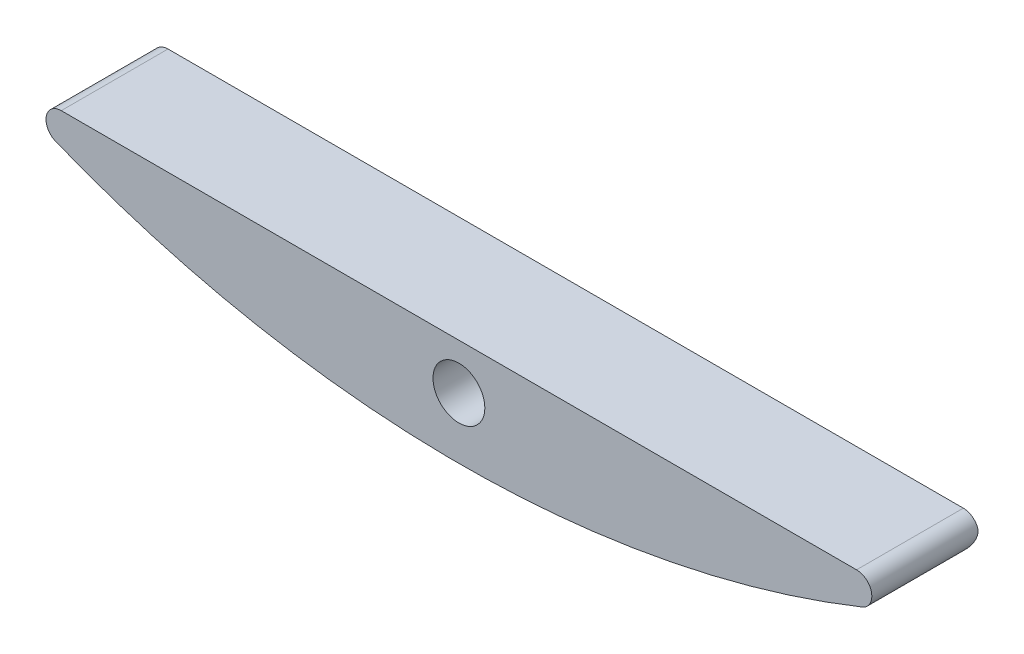
from build123d import *

# Parameters (mm, degrees)
EXTRUDE_START            = -2.25
EXTRUDE_2_OUTLINE_R      = 7.6
EXTRUDE_2_DEPTH          = 4.5
FILLET_1_R               = 20
EXTRUDE_6_DEPTH          = 7
FILLET_5_R               = 1
CUT_EXTRUDE_3_DEPTH      = 120.048972165
CUT_EXTRUDE_3_DEPTH_BACK = 120.048972165


# Read off the part's stored shape, not the designer's step: Бобышка-Вытянуть2
with BuildPart() as part:
    # Бобышка-Вытянуть2 outline → Бобышка-Вытянуть2 (new body)
    with BuildSketch(Plane.XY.offset(EXTRUDE_START)):
        with BuildLine():
            add(Edge.make_bspline(
                [(-65.4, -39.40914805), (-65.4, -47.175816893), (-62.002230156, -62.709154577), (-47.47251585, -82.482509686), (-25.700369735, -95.710351943), (0, -100.358546104), (25.700369735, -95.710351943), (47.47251585, -82.482509686), (62.002230156, -62.709154577), (67.098884922, -39.40914805), (62.002230156, -16.109141524), (47.47251585, 3.664213585), (25.700369735, 16.892055843), (0, 21.540250003), (-25.700369735, 16.892055843), (-47.47251585, 3.664213585), (-62.002230156, -16.109141524), (-65.4, -31.642479208), (-65.4, -39.40914805)],
                knots=[0, 0, 0, 0, 0.392699082, 0.785398163, 1.178097245, 1.570796327, 1.963495408, 2.35619449, 2.748893572, 3.141592654, 3.534291735, 3.926990817, 4.319689899, 4.71238898, 5.105088062, 5.497787144, 5.890486225, 6.283185307, 6.283185307, 6.283185307, 6.283185307], degree=3))
        make_face()
        with BuildLine():
            add(Edge.make_bspline(
                [(-50.377711226, -9.40914805), (-50.920216849, -10.147880044), (-53.009488643, -13.148970519), (-58.287053578, -22.675724676), (-60.4, -32.361278425), (-60.4, -39.40914805), (-60.4, -46.457017676), (-57.531501115, -59.605955028), (-48.578428032, -72.525678375), (-42.381106639, -78.200739223), (-40.925271095, -79.40914805)],
                knots=[5.694527978, 5.694527978, 5.694527978, 5.694527978, 5.74351754, 5.890486225, 6.283185307, 6.283185307, 6.283185307, 6.675884389, 7.015828772, 7.114003543, 7.114003543, 7.114003543, 7.114003543], degree=3))
            Line((-50.377711226, -9.40914805), (-12.131830741, -18.974848484))
            ThreePointArc((-12.131830741, -18.974848484), (0, -20.468986128), (12.131830741, -18.974848484))
            Line((12.131830741, -18.974848484), (50.373795788, -9.410127343))
            add(Edge.make_bspline(
                [(40.925271095, -79.40914805), (42.381106639, -78.200739223), (48.578428032, -72.525678375), (57.531501115, -59.605955028), (61.937523955, -39.40914805), (58.09524141, -21.796475187), (52.543848483, -12.36529325), (50.373795788, -9.410127343)],
                knots=[2.310774418, 2.310774418, 2.310774418, 2.310774418, 2.408949189, 2.748893572, 3.141592654, 3.534291735, 3.730251177, 3.730251177, 3.730251177, 3.730251177], degree=3))
            Line((40.925271095, -79.40914805), (-40.925271095, -79.40914805))
        make_face(mode=Mode.SUBTRACT)
        with Locations((0, -9.40914805)):
            Circle(EXTRUDE_2_OUTLINE_R, mode=Mode.SUBTRACT)
    extrude(amount=EXTRUDE_2_DEPTH)

    # Скругление1
    fillet_1_edges = [part.edges().sort_by_distance(p)[0] for p in [
        (50.373795788, -9.410127343, 0),
        (-50.377711226, -9.40914805, 0),
        (-40.925271095, -79.40914805, 0),
        (40.925271095, -79.40914805, 0),
    ]]
    fillet(fillet_1_edges, radius=FILLET_1_R)


with BuildPart() as body_2:
    # Эскиз5 → Бобышка-Вытянуть6 (new body)
    with BuildSketch(Plane(origin=(0, 0, -2.25), x_dir=(-1, 0, 0), z_dir=(0, 0, -1))):
        with BuildLine():
            Line((-30.79471813, -91.80914805), (30.79471813, -91.80914805))
            add(Edge.make_bspline(
                [(-30.79471813, -91.80914805), (-28.92410717, -92.717157206), (-19.255000826, -96.876067707), (0, -100.358546104), (19.255000826, -96.876067707), (28.92410717, -92.717157206), (30.79471813, -91.80914805)],
                knots=[4.222444596, 4.222444596, 4.222444596, 4.222444596, 4.319689899, 4.71238898, 5.105088062, 5.202333365, 5.202333365, 5.202333365, 5.202333365], degree=3))
        make_face()
    extrude(amount=EXTRUDE_6_DEPTH)

    # Скругление5
    fillet_5_edges = [body_2.edges().sort_by_distance(p)[0] for p in [
        (0, -98.80914805, -9.25),
        (30.79471813, -91.80914805, -5.75),
        (-30.79471813, -91.80914805, -5.75),
    ]]
    fillet(fillet_5_edges, radius=FILLET_5_R)


with BuildPart() as cut_extrude_3_tool:
    # Эскиз7 → Вырез-Вытянуть3 (new, two sides: drawn at the far end of the back side and taken through both)
    with BuildSketch(Plane(origin=(0, 0, -9.25), x_dir=(-1, 0, 0), z_dir=(0, 0, -1)).offset(-CUT_EXTRUDE_3_DEPTH_BACK)):
        with BuildLine():
            ThreePointArc((1.7, -94.8091481), (1.202081528, -93.607066572), (0, -93.1091481))
            Line((0, -93.1091481), (0, -96.5091481))
            ThreePointArc((0, -96.5091481), (1.202081528, -96.011229629), (1.7, -94.8091481))
        make_face()
        with BuildLine():
            Line((0, -96.5091481), (0, -93.1091481))
            ThreePointArc((0, -93.1091481), (-1.7, -94.8091481), (0, -96.5091481))
        make_face()
    extrude(amount=CUT_EXTRUDE_3_DEPTH + CUT_EXTRUDE_3_DEPTH_BACK)


with BuildPart() as part_1:
    add(part.part)

    # Вырез-Вытянуть3: cut by cut_extrude_3_tool
    add(cut_extrude_3_tool.part, mode=Mode.SUBTRACT)


with BuildPart() as body_2_1:
    add(body_2.part)

    # Вырез-Вытянуть3: cut by cut_extrude_3_tool
    add(cut_extrude_3_tool.part, mode=Mode.SUBTRACT)


solid = body_2_1.part
